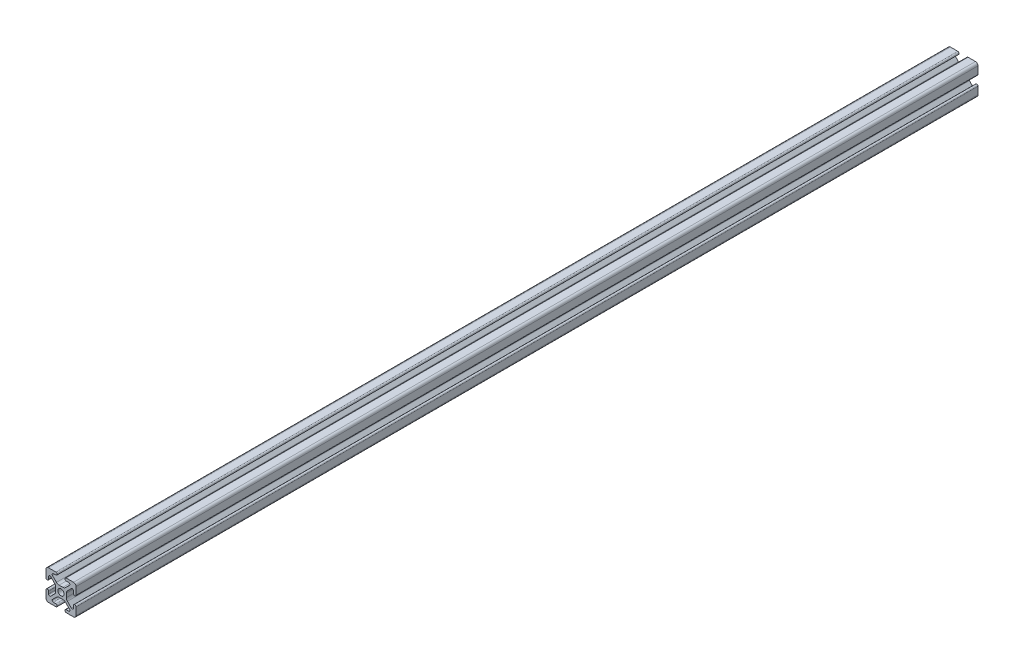
from build123d import *

# Parameters (mm, degrees)
SKETCH1_R           = 2.6035
BOSS_EXTRUDE1_DEPTH = 762
DELETEFACE1_START   = -762
DELETEFACE1_DEPTH   = 762


# Read off the part's stored shape, not the designer's step: DeleteFace1
with BuildPart() as part:
    # Sketch1 → Boss-Extrude1 (new body)
    with BuildSketch(Plane.XY):
        with BuildLine():
            Line((-9.5504, -12.7), (-6.3330836, -12.7))
            ThreePointArc((-6.3330836, -12.7), (-5.8250836, -12.192), (-5.3170836, -12.7))
            Line((-5.3170836, -12.7), (-4.343399971, -12.7))
            ThreePointArc((-4.343399971, -12.7), (-3.238499971, -11.5951), (-4.343399971, -10.4902))
            Line((-4.343399971, -10.4902), (-6.474794456, -10.4902))
            ThreePointArc((-6.474794456, -10.4902), (-7.413456061, -9.863006367), (-7.193214945, -8.75577951))
            Line((-7.193214945, -8.75577951), (-3.863171405, -5.42573597))
            ThreePointArc((-3.863171405, -5.42573597), (-2.833127272, -4.737482484), (-1.618107374, -4.4958))
            Line((-1.618107374, -4.4958), (1.618107374, -4.4958))
            ThreePointArc((1.618107374, -4.4958), (2.833127272, -4.737482484), (3.863171405, -5.42573597))
            Line((3.863171405, -5.42573597), (7.193214945, -8.75577951))
            ThreePointArc((7.193214945, -8.75577951), (7.413456061, -9.863006367), (6.474794456, -10.4902))
            Line((6.474794456, -10.4902), (4.3434, -10.4902))
            ThreePointArc((4.3434, -10.4902), (3.2385, -11.5951), (4.3434, -12.7))
            Line((4.3434, -12.7), (5.3170836, -12.7))
            ThreePointArc((5.3170836, -12.7), (5.8250836, -12.192), (6.3330836, -12.7))
            Line((6.3330836, -12.7), (9.5504, -12.7))
            ThreePointArc((9.5504, -12.7), (10.058323491, -12.192000006), (10.566399977, -12.699846982))
            ThreePointArc((10.566399977, -12.699846982), (12.082522516, -12.082522516), (12.699846982, -10.566399977))
            ThreePointArc((12.699846982, -10.566399977), (12.192000006, -10.058323491), (12.7, -9.5504))
            Line((12.7, -9.5504), (12.7, -6.3330836))
            ThreePointArc((12.7, -6.3330836), (12.192, -5.8250836), (12.7, -5.3170836))
            Line((12.7, -5.3170836), (12.7, -4.343399971))
            ThreePointArc((12.7, -4.343399971), (11.5951, -3.238499971), (10.4902, -4.343399971))
            Line((10.4902, -4.343399971), (10.4902, -6.474794456))
            ThreePointArc((10.4902, -6.474794456), (9.863006367, -7.413456061), (8.75577951, -7.193214945))
            Line((8.75577951, -7.193214945), (5.42573597, -3.863171405))
            ThreePointArc((5.42573597, -3.863171405), (4.737482484, -2.833127272), (4.4958, -1.618107374))
            Line((4.4958, -1.618107374), (4.4958, 1.618107374))
            ThreePointArc((4.4958, 1.618107374), (4.737482484, 2.833127272), (5.42573597, 3.863171405))
            Line((5.42573597, 3.863171405), (8.75577951, 7.193214945))
            ThreePointArc((8.75577951, 7.193214945), (9.863006367, 7.413456061), (10.4902, 6.474794456))
            Line((10.4902, 6.474794456), (10.4902, 4.3434))
            ThreePointArc((10.4902, 4.3434), (11.5951, 3.2385), (12.7, 4.3434))
            Line((12.7, 4.3434), (12.7, 5.3170836))
            ThreePointArc((12.7, 5.3170836), (12.192, 5.8250836), (12.7, 6.3330836))
            Line((12.7, 6.3330836), (12.7, 9.5504))
            ThreePointArc((12.7, 9.5504), (12.192000006, 10.058323491), (12.699846982, 10.566399977))
            ThreePointArc((12.699846982, 10.566399977), (12.082522516, 12.082522516), (10.566399977, 12.699846982))
            ThreePointArc((10.566399977, 12.699846982), (10.058323491, 12.192000006), (9.5504, 12.7))
            Line((9.5504, 12.7), (6.3330836, 12.7))
            ThreePointArc((6.3330836, 12.7), (5.8250836, 12.192), (5.3170836, 12.7))
            Line((5.3170836, 12.7), (4.343399971, 12.7))
            ThreePointArc((4.343399971, 12.7), (3.238499971, 11.5951), (4.343399971, 10.4902))
            Line((4.343399971, 10.4902), (6.474794456, 10.4902))
            ThreePointArc((6.474794456, 10.4902), (7.413456061, 9.863006367), (7.193214945, 8.75577951))
            Line((7.193214945, 8.75577951), (3.863171405, 5.42573597))
            ThreePointArc((3.863171405, 5.42573597), (2.833127272, 4.737482484), (1.618107374, 4.4958))
            Line((1.618107374, 4.4958), (-1.618107374, 4.4958))
            ThreePointArc((-1.618107374, 4.4958), (-2.833127272, 4.737482484), (-3.863171405, 5.42573597))
            Line((-3.863171405, 5.42573597), (-7.193214945, 8.75577951))
            ThreePointArc((-7.193214945, 8.75577951), (-7.413456061, 9.863006367), (-6.474794456, 10.4902))
            Line((-6.474794456, 10.4902), (-4.3434, 10.4902))
            ThreePointArc((-4.3434, 10.4902), (-3.2385, 11.5951), (-4.3434, 12.7))
            Line((-4.3434, 12.7), (-5.3170836, 12.7))
            ThreePointArc((-5.3170836, 12.7), (-5.8250836, 12.192), (-6.3330836, 12.7))
            Line((-6.3330836, 12.7), (-9.5504, 12.7))
            ThreePointArc((-9.5504, 12.7), (-10.058323491, 12.192000006), (-10.566399977, 12.699846982))
            ThreePointArc((-10.566399977, 12.699846982), (-12.082522516, 12.082522516), (-12.699846982, 10.566399977))
            ThreePointArc((-12.699846982, 10.566399977), (-12.192000006, 10.058323491), (-12.7, 9.5504))
            Line((-12.7, 9.5504), (-12.7, 6.3330836))
            ThreePointArc((-12.7, 6.3330836), (-12.192, 5.8250836), (-12.7, 5.3170836))
            Line((-12.7, 5.3170836), (-12.7, 4.343399971))
            ThreePointArc((-12.7, 4.343399971), (-11.5951, 3.238499971), (-10.4902, 4.343399971))
            Line((-10.4902, 4.343399971), (-10.4902, 6.474794456))
            ThreePointArc((-10.4902, 6.474794456), (-9.863006367, 7.413456061), (-8.75577951, 7.193214945))
            Line((-8.75577951, 7.193214945), (-5.42573597, 3.863171405))
            ThreePointArc((-5.42573597, 3.863171405), (-4.737482484, 2.833127272), (-4.4958, 1.618107374))
            Line((-4.4958, 1.618107374), (-4.4958, -1.618107374))
            ThreePointArc((-4.4958, -1.618107374), (-4.737482484, -2.833127272), (-5.42573597, -3.863171405))
            Line((-5.42573597, -3.863171405), (-8.75577951, -7.193214945))
            ThreePointArc((-8.75577951, -7.193214945), (-9.863006367, -7.413456061), (-10.4902, -6.474794456))
            Line((-10.4902, -6.474794456), (-10.4902, -4.3434))
            ThreePointArc((-10.4902, -4.3434), (-11.5951, -3.2385), (-12.7, -4.3434))
            Line((-12.7, -4.3434), (-12.7, -5.3170836))
            ThreePointArc((-12.7, -5.3170836), (-12.192, -5.8250836), (-12.7, -6.3330836))
            Line((-12.7, -6.3330836), (-12.7, -9.5504))
            ThreePointArc((-12.7, -9.5504), (-12.192000006, -10.058323491), (-12.699846982, -10.566399977))
            ThreePointArc((-12.699846982, -10.566399977), (-12.082522516, -12.082522516), (-10.566399977, -12.699846982))
            ThreePointArc((-10.566399977, -12.699846982), (-10.058323491, -12.192000006), (-9.5504, -12.7))
        make_face()
        with Locations(Location((0, 0, 0), (0, 0, 180))):
            Circle(SKETCH1_R, mode=Mode.SUBTRACT)
    extrude(amount=-BOSS_EXTRUDE1_DEPTH)

    # DeleteFace1 outline → DeleteFace1 (add)
    with BuildSketch(Plane.XY.offset(DELETEFACE1_START)):
        with BuildLine():
            ThreePointArc((-12.7, -6.3330836), (-12.192, -5.8250836), (-12.7, -5.3170836))
            Line((-12.7, -5.3170836), (-12.7, -6.3330836))
        make_face()
        with BuildLine():
            ThreePointArc((-5.3170836, -12.7), (-5.8250836, -12.192), (-6.3330836, -12.7))
            Line((-6.3330836, -12.7), (-5.3170836, -12.7))
        make_face()
        with BuildLine():
            ThreePointArc((-10.566399977, -12.699846982), (-10.579099758, -12.699961745), (-10.5918, -12.7))
            Line((-10.5918, -12.7), (-9.5504, -12.7))
            ThreePointArc((-9.5504, -12.7), (-10.058323491, -12.192000006), (-10.566399977, -12.699846982))
        make_face()
        with BuildLine():
            ThreePointArc((-12.699846982, -10.566399977), (-12.192000006, -10.058323491), (-12.7, -9.5504))
            Line((-12.7, -9.5504), (-12.7, -10.5918))
            ThreePointArc((-12.7, -10.5918), (-12.699961745, -10.579099758), (-12.699846982, -10.566399977))
        make_face()
        with BuildLine():
            ThreePointArc((-12.699846982, 10.566399977), (-12.699961745, 10.579099758), (-12.7, 10.5918))
            Line((-12.7, 10.5918), (-12.7, 9.5504))
            ThreePointArc((-12.7, 9.5504), (-12.192000006, 10.058323491), (-12.699846982, 10.566399977))
        make_face()
        with BuildLine():
            Line((-5.3170836, 12.7), (-6.3330836, 12.7))
            ThreePointArc((-6.3330836, 12.7), (-5.8250836, 12.192), (-5.3170836, 12.7))
        make_face()
        with BuildLine():
            Line((-9.5504, 12.7), (-10.5918, 12.7))
            ThreePointArc((-10.5918, 12.7), (-10.579099758, 12.699961745), (-10.566399977, 12.699846982))
            ThreePointArc((-10.566399977, 12.699846982), (-10.058323491, 12.192000006), (-9.5504, 12.7))
        make_face()
        with BuildLine():
            ThreePointArc((-12.7, 5.3170836), (-12.192, 5.8250836), (-12.7, 6.3330836))
            Line((-12.7, 6.3330836), (-12.7, 5.3170836))
        make_face()
        with BuildLine():
            ThreePointArc((10.566399977, 12.699846982), (10.579099758, 12.699961745), (10.5918, 12.7))
            Line((10.5918, 12.7), (9.5504, 12.7))
            ThreePointArc((9.5504, 12.7), (10.058323491, 12.192000006), (10.566399977, 12.699846982))
        make_face()
        with BuildLine():
            Line((12.7, 5.3170836), (12.7, 6.3330836))
            ThreePointArc((12.7, 6.3330836), (12.192, 5.8250836), (12.7, 5.3170836))
        make_face()
        with BuildLine():
            Line((12.7, 9.5504), (12.7, 10.5918))
            ThreePointArc((12.7, 10.5918), (12.699961745, 10.579099758), (12.699846982, 10.566399977))
            ThreePointArc((12.699846982, 10.566399977), (12.192000006, 10.058323491), (12.7, 9.5504))
        make_face()
        with BuildLine():
            ThreePointArc((5.3170836, 12.7), (5.8250836, 12.192), (6.3330836, 12.7))
            Line((6.3330836, 12.7), (5.3170836, 12.7))
        make_face()
        with BuildLine():
            ThreePointArc((12.699846982, -10.566399977), (12.699961745, -10.579099758), (12.7, -10.5918))
            Line((12.7, -10.5918), (12.7, -9.5504))
            ThreePointArc((12.7, -9.5504), (12.192000006, -10.058323491), (12.699846982, -10.566399977))
        make_face()
        with BuildLine():
            Line((5.3170836, -12.7), (6.3330836, -12.7))
            ThreePointArc((6.3330836, -12.7), (5.8250836, -12.192), (5.3170836, -12.7))
        make_face()
        with BuildLine():
            Line((9.5504, -12.7), (10.5918, -12.7))
            ThreePointArc((10.5918, -12.7), (10.579099758, -12.699961745), (10.566399977, -12.699846982))
            ThreePointArc((10.566399977, -12.699846982), (10.058323491, -12.192000006), (9.5504, -12.7))
        make_face()
        with BuildLine():
            ThreePointArc((12.7, -5.3170836), (12.192, -5.8250836), (12.7, -6.3330836))
            Line((12.7, -6.3330836), (12.7, -5.3170836))
        make_face()
    extrude(amount=DELETEFACE1_DEPTH)


solid = part.part
